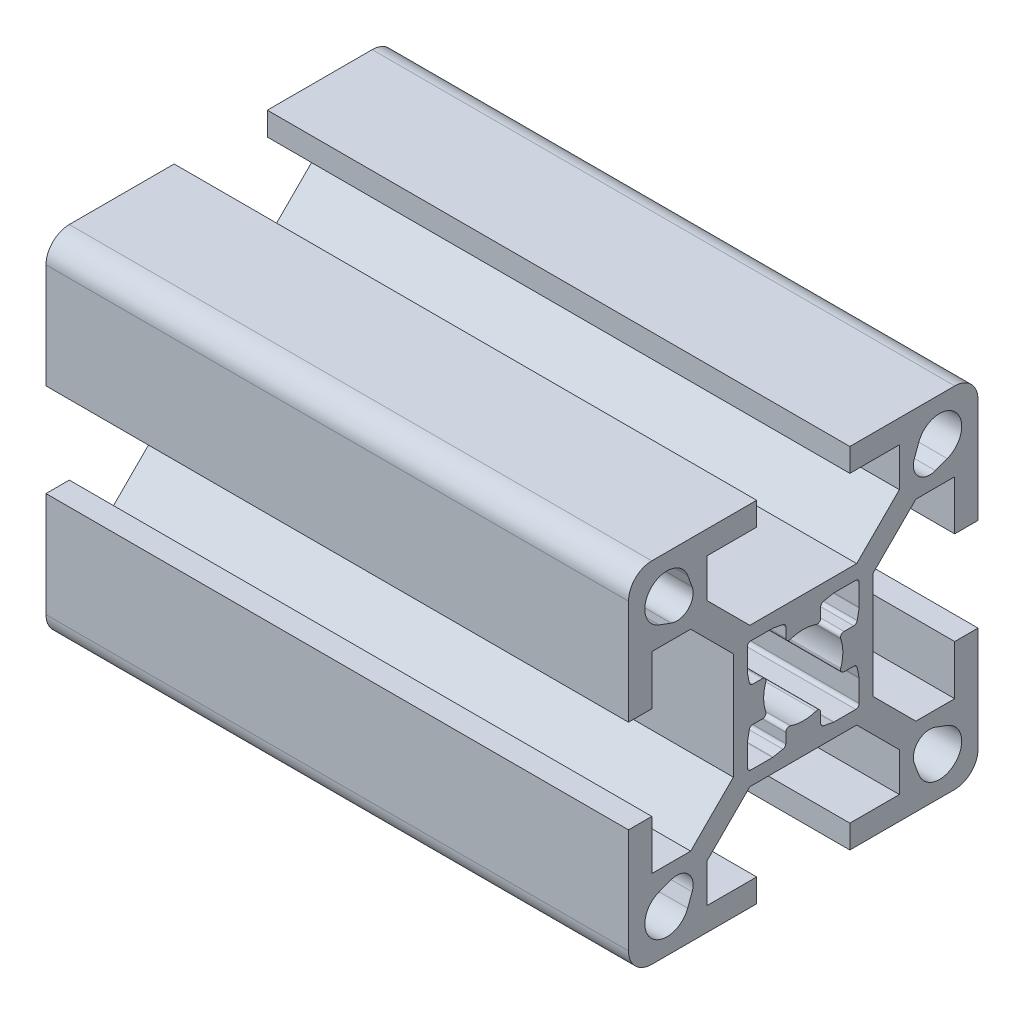
from build123d import *

# Parameters (mm, degrees)
BOSS_EXTRUDE1_DEPTH = 50


with BuildPart() as part:
    # Sketch1 → Boss-Extrude1 (new body)
    with BuildSketch(Plane(origin=(0, 0, 0), x_dir=(0, 0, -1), z_dir=(1, 0, 0))):
        with BuildLine():
            Line((-15, 13), (-15, 4))
            Line((-15, 4), (-13, 4))
            Line((-13, 4), (-13, 8.25))
            Line((-13, 8.25), (-9.664213562, 8.25))
            Line((-9.664213562, 8.25), (-6, 4.585786438))
            Line((-6, 4.585786438), (-6, -4.585786438))
            Line((-6, -4.585786438), (-9.664213562, -8.25))
            Line((-9.664213562, -8.25), (-13, -8.25))
            Line((-13, -8.25), (-13, -4))
            Line((-13, -4), (-15, -4))
            Line((-15, -4), (-15, -13))
            ThreePointArc((-15, -13), (-14.414213562, -14.414213562), (-13, -15))
            Line((-13, -15), (-4, -15))
            Line((-4, -15), (-4, -13))
            Line((-4, -13), (-8.25, -13))
            Line((-8.25, -13), (-8.25, -9.664213562))
            Line((-8.25, -9.664213562), (-4.585786438, -6))
            Line((-4.585786438, -6), (4.585786438, -6))
            Line((4.585786438, -6), (8.25, -9.664213562))
            Line((8.25, -9.664213562), (8.25, -13))
            Line((8.25, -13), (4, -13))
            Line((4, -13), (4, -15))
            Line((4, -15), (13, -15))
            ThreePointArc((13, -15), (14.414213562, -14.414213562), (15, -13))
            Line((15, -13), (15, -4))
            Line((15, -4), (13, -4))
            Line((13, -4), (13, -8.25))
            Line((13, -8.25), (9.664213562, -8.25))
            Line((9.664213562, -8.25), (6, -4.585786438))
            Line((6, -4.585786438), (6, 4.585786438))
            Line((6, 4.585786438), (9.664213562, 8.25))
            Line((9.664213562, 8.25), (13, 8.25))
            Line((13, 8.25), (13, 4))
            Line((13, 4), (15, 4))
            Line((15, 4), (15, 13))
            ThreePointArc((15, 13), (14.414213562, 14.414213562), (13, 15))
            Line((13, 15), (4, 15))
            Line((4, 15), (4, 13))
            Line((4, 13), (8.25, 13))
            Line((8.25, 13), (8.25, 9.664213562))
            Line((8.25, 9.664213562), (4.585786438, 6))
            Line((4.585786438, 6), (-4.585786438, 6))
            Line((-4.585786438, 6), (-8.25, 9.664213562))
            Line((-8.25, 9.664213562), (-8.25, 13))
            Line((-8.25, 13), (-4, 13))
            Line((-4, 13), (-4, 15))
            Line((-4, 15), (-13, 15))
            ThreePointArc((-13, 15), (-14.414213562, 14.414213562), (-15, 13))
        make_face()
        with BuildLine():
            Line((-9.539070071, 11.338915743), (-9.918883282, 12.361530981))
            ThreePointArc((-9.918883282, 12.361530981), (-13.043502884, 13.043502884), (-12.361530981, 9.918883282))
            Line((-12.361530981, 9.918883282), (-11.338915743, 9.539070071))
            ThreePointArc((-11.338915743, 9.539070071), (-9.861522369, 9.861522369), (-9.539070071, 11.338915743))
        make_face(mode=Mode.SUBTRACT)
        with BuildLine():
            Line((9.918883282, 12.361530981), (9.539070071, 11.338915743))
            ThreePointArc((9.539070071, 11.338915743), (9.861522369, 9.861522369), (11.338915743, 9.539070071))
            Line((11.338915743, 9.539070071), (12.361530981, 9.918883282))
            ThreePointArc((12.361530981, 9.918883282), (13.043502884, 13.043502884), (9.918883282, 12.361530981))
        make_face(mode=Mode.SUBTRACT)
        with BuildLine():
            Line((12.361530981, -9.918883282), (11.338915743, -9.539070071))
            ThreePointArc((11.338915743, -9.539070071), (9.861522369, -9.861522369), (9.539070071, -11.338915743))
            Line((9.539070071, -11.338915743), (9.918883282, -12.361530981))
            ThreePointArc((9.918883282, -12.361530981), (13.043502884, -13.043502884), (12.361530981, -9.918883282))
        make_face(mode=Mode.SUBTRACT)
        with BuildLine():
            Line((-11.338915743, -9.539070071), (-12.361530981, -9.918883282))
            ThreePointArc((-12.361530981, -9.918883282), (-13.043502884, -13.043502884), (-9.918883282, -12.361530981))
            Line((-9.918883282, -12.361530981), (-9.539070071, -11.338915743))
            ThreePointArc((-9.539070071, -11.338915743), (-9.861522369, -9.861522369), (-11.338915743, -9.539070071))
        make_face(mode=Mode.SUBTRACT)
        with BuildLine():
            Line((-4.8, -2.644433572), (-4.8, -4.5))
            ThreePointArc((-4.8, -4.5), (-4.712132034, -4.712132034), (-4.5, -4.8))
            Line((-4.5, -4.8), (-2.644433572, -4.8))
            ThreePointArc((-2.644433572, -4.8), (-2.615679847, -4.79861886), (-2.587190874, -4.794488155))
            Line((-2.587190874, -4.794488155), (-1.742757301, -4.630346896))
            ThreePointArc((-1.742757301, -4.630346896), (-1.568512625, -4.526682207), (-1.5, -4.335858741))
            Line((-1.5, -4.335858741), (-1.5, -3.5))
            ThreePointArc((-1.5, -3.5), (-1.374371458, -3.255879959), (-1.102702703, -3.216216216))
            ThreePointArc((-1.102702703, -3.216216216), (0, -3.4), (1.102702703, -3.216216216))
            ThreePointArc((1.102702703, -3.216216216), (1.374371458, -3.255879959), (1.5, -3.5))
            Line((1.5, -3.5), (1.5, -4.335858741))
            ThreePointArc((1.5, -4.335858741), (1.568512625, -4.526682207), (1.742757301, -4.630346896))
            Line((1.742757301, -4.630346896), (2.587190874, -4.794488155))
            ThreePointArc((2.587190874, -4.794488155), (2.615679847, -4.79861886), (2.644433572, -4.8))
            Line((2.644433572, -4.8), (4.5, -4.8))
            ThreePointArc((4.5, -4.8), (4.712132034, -4.712132034), (4.8, -4.5))
            Line((4.8, -4.5), (4.8, -2.644433572))
            ThreePointArc((4.8, -2.644433572), (4.79861886, -2.615679847), (4.794488155, -2.587190874))
            Line((4.794488155, -2.587190874), (4.630346896, -1.742757301))
            ThreePointArc((4.630346896, -1.742757301), (4.526682207, -1.568512625), (4.335858741, -1.5))
            Line((4.335858741, -1.5), (3.5, -1.5))
            ThreePointArc((3.5, -1.5), (3.255879959, -1.374371458), (3.216216216, -1.102702703))
            ThreePointArc((3.216216216, -1.102702703), (3.4, 0), (3.216216216, 1.102702703))
            ThreePointArc((3.216216216, 1.102702703), (3.255879959, 1.374371458), (3.5, 1.5))
            Line((3.5, 1.5), (4.335858741, 1.5))
            ThreePointArc((4.335858741, 1.5), (4.526682207, 1.568512625), (4.630346896, 1.742757301))
            Line((4.630346896, 1.742757301), (4.794488155, 2.587190874))
            ThreePointArc((4.794488155, 2.587190874), (4.79861886, 2.615679847), (4.8, 2.644433572))
            Line((4.8, 2.644433572), (4.8, 4.5))
            ThreePointArc((4.8, 4.5), (4.712132034, 4.712132034), (4.5, 4.8))
            Line((4.5, 4.8), (2.644433572, 4.8))
            ThreePointArc((2.644433572, 4.8), (2.615679847, 4.79861886), (2.587190874, 4.794488155))
            Line((2.587190874, 4.794488155), (1.742757301, 4.630346896))
            ThreePointArc((1.742757301, 4.630346896), (1.568512625, 4.526682207), (1.5, 4.335858741))
            Line((1.5, 4.335858741), (1.5, 3.5))
            ThreePointArc((1.5, 3.5), (1.374371458, 3.255879959), (1.102702703, 3.216216216))
            ThreePointArc((1.102702703, 3.216216216), (0, 3.4), (-1.102702703, 3.216216216))
            ThreePointArc((-1.102702703, 3.216216216), (-1.374371458, 3.255879959), (-1.5, 3.5))
            Line((-1.5, 3.5), (-1.5, 4.335858741))
            ThreePointArc((-1.5, 4.335858741), (-1.568512625, 4.526682207), (-1.742757301, 4.630346896))
            Line((-1.742757301, 4.630346896), (-2.587190874, 4.794488155))
            ThreePointArc((-2.587190874, 4.794488155), (-2.615679847, 4.79861886), (-2.644433572, 4.8))
            Line((-2.644433572, 4.8), (-4.5, 4.8))
            ThreePointArc((-4.5, 4.8), (-4.712132034, 4.712132034), (-4.8, 4.5))
            Line((-4.8, 4.5), (-4.8, 2.644433572))
            ThreePointArc((-4.8, 2.644433572), (-4.79861886, 2.615679847), (-4.794488155, 2.587190874))
            Line((-4.794488155, 2.587190874), (-4.630346896, 1.742757301))
            ThreePointArc((-4.630346896, 1.742757301), (-4.526682207, 1.568512625), (-4.335858741, 1.5))
            Line((-4.335858741, 1.5), (-3.5, 1.5))
            ThreePointArc((-3.5, 1.5), (-3.255879959, 1.374371458), (-3.216216216, 1.102702703))
            ThreePointArc((-3.216216216, 1.102702703), (-3.4, 0), (-3.216216216, -1.102702703))
            ThreePointArc((-3.216216216, -1.102702703), (-3.255879959, -1.374371458), (-3.5, -1.5))
            Line((-3.5, -1.5), (-4.335858741, -1.5))
            ThreePointArc((-4.335858741, -1.5), (-4.526682207, -1.568512625), (-4.630346896, -1.742757301))
            Line((-4.630346896, -1.742757301), (-4.794488155, -2.587190874))
            ThreePointArc((-4.794488155, -2.587190874), (-4.79861886, -2.615679847), (-4.8, -2.644433572))
        make_face(mode=Mode.SUBTRACT)
    extrude(amount=BOSS_EXTRUDE1_DEPTH)


solid = part.part
